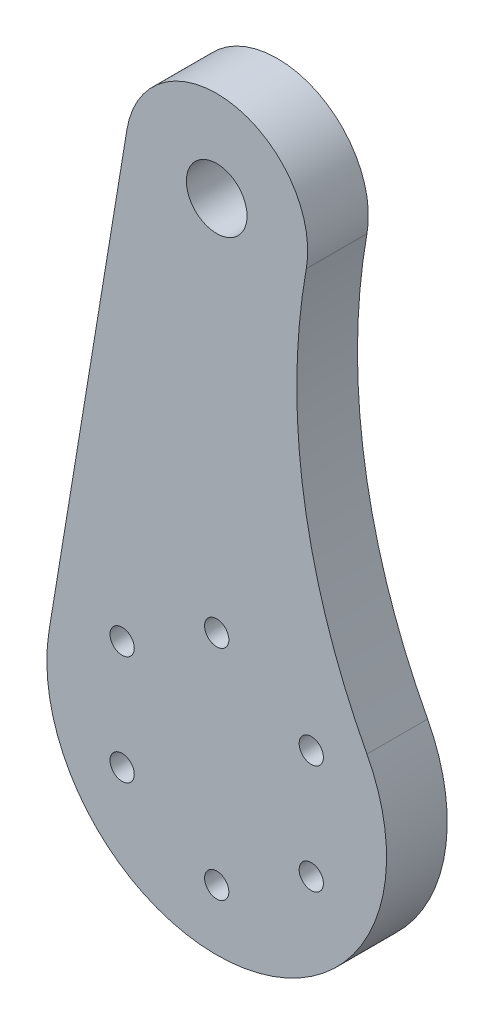
from build123d import *

# Parameters (mm, degrees)
SKETCH1_R           = 2
SKETCH1_R_2         = 5
BOSS_EXTRUDE1_DEPTH = 10


with BuildPart() as part:
    # Sketch1 → Boss-Extrude1 (new body)
    with BuildSketch(Plane(origin=(0, 0, 0), x_dir=(0, 1, 0), z_dir=(0, 0, 1))):
        with BuildLine():
            Line((82.4375, 14.800628154), (4.55, 27.627839221))
            ThreePointArc((4.55, 27.627839221), (-27.637021647, -4.493888572), (13.068945313, -24.762929318))
            ThreePointArc((13.068945312, -24.762929318), (44.377619117, -14.389604961), (77.357880435, -14.765473382))
            ThreePointArc((77.357880435, -14.765473382), (94.783404794, -2.539870606), (82.4375, 14.800628154))
        make_face()
        with Locations((-9, -15.588457268)):
            Circle(SKETCH1_R, mode=Mode.SUBTRACT)
        with Locations((9, -15.588457268)):
            Circle(SKETCH1_R, mode=Mode.SUBTRACT)
        with Locations((-18, 0)):
            Circle(SKETCH1_R, mode=Mode.SUBTRACT)
        with Locations((18, 0)):
            Circle(SKETCH1_R, mode=Mode.SUBTRACT)
        with Locations((-9, 15.588457268)):
            Circle(SKETCH1_R, mode=Mode.SUBTRACT)
        with Locations((9, 15.588457268)):
            Circle(SKETCH1_R, mode=Mode.SUBTRACT)
        with Locations((80, 0)):
            Circle(SKETCH1_R_2, mode=Mode.SUBTRACT)
    extrude(amount=BOSS_EXTRUDE1_DEPTH)


solid = part.part
